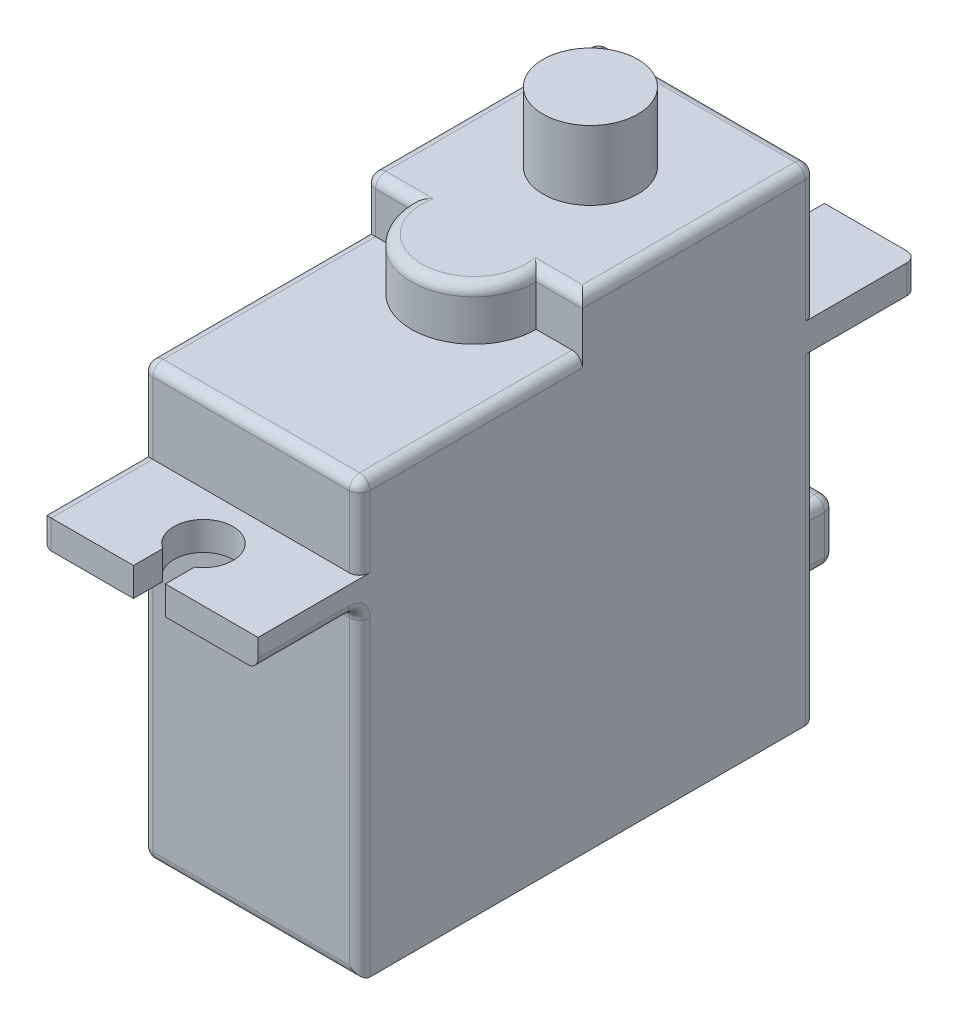
from build123d import *

# Parameters (mm, degrees)
BASE_SKETCH_W           = 13.3096
BASE_SKETCH_H           = 27.94
BASE_DEPTH              = 19.6977
MOUNTING_POINT_SKETCH_W = 13.3096
MOUNTING_POINT_SKETCH_H = 40.386
MOUNTING_POINT_DEPTH    = 1.7526
MOUNTING_HOLES_DEPTH    = 43.477892971
MIDDLE_SKETCH_W         = 13.3096
MIDDLE_SKETCH_H         = 27.94
MIDDLE_DEPTH            = 4.9911
TOP_EXTRUDE_DEPTH       = 3.1496
GEAR_SKETCH_R           = 2.9083
GEAR_DEPTH              = 4.2418
SERVO_CABLE_SKETCH_W    = 5.3594
SERVO_CABLE_SKETCH_H    = 3.6576
SEVO_CABLE_DEPTH        = 5.1562
FILLET1_R               = 0.635


with BuildPart() as part:
    # Base Sketch → Base (new body)
    with BuildSketch(Plane(origin=(0, 0, 0), x_dir=(1, 0, 0), z_dir=(0, 1, 0))):
        with Locations((6.6548, 13.97)):
            Rectangle(BASE_SKETCH_W, BASE_SKETCH_H)
    extrude(amount=BASE_DEPTH)

    # Mounting Point Sketch → Mounting Point (add)
    with BuildSketch(Plane(origin=(0, 19.6977, 0), x_dir=(1, 0, 0), z_dir=(0, 1, 0))):
        with Locations((6.6548, 13.97)):
            Rectangle(MOUNTING_POINT_SKETCH_W, MOUNTING_POINT_SKETCH_H)
    extrude(amount=MOUNTING_POINT_DEPTH)

    # Mounting Holes Sketch → Mounting Holes (cut, through all)
    with BuildSketch(Plane(origin=(0, 21.4503, 0), x_dir=(1, 0, 0), z_dir=(0, 1, 0))):
        with BuildLine():
            Line((5.6769, 34.163), (7.6327, 34.163))
            Line((7.6327, 34.163), (7.6327, 32.37744567))
            ThreePointArc((7.6327, 32.37744567), (6.6548, 29.0449), (5.6769, 32.37744567))
            Line((5.6769, 32.37744567), (5.6769, 34.163))
        make_face()
        with BuildLine():
            Line((5.6769, -6.223), (7.6327, -6.223))
            Line((7.6327, -6.223), (7.6327, -4.43744567))
            ThreePointArc((7.6327, -4.43744567), (6.6548, -1.1049), (5.6769, -4.43744567))
            Line((5.6769, -4.43744567), (5.6769, -6.223))
        make_face()
    extrude(amount=-MOUNTING_HOLES_DEPTH, mode=Mode.SUBTRACT)

    # Middle Sketch → Middle (add)
    with BuildSketch(Plane(origin=(0, 21.4503, 0), x_dir=(1, 0, 0), z_dir=(0, 1, 0))):
        with Locations((6.6548, 13.97)):
            Rectangle(MIDDLE_SKETCH_W, MIDDLE_SKETCH_H)
    extrude(amount=MIDDLE_DEPTH)

    # Top Sketch → Top extrude (add)
    with BuildSketch(Plane(origin=(0, 26.4414, 0), x_dir=(1, 0, 0), z_dir=(0, 1, 0))):
        with BuildLine():
            Line((0, 27.94), (13.3096, 27.94))
            Line((13.3096, 27.94), (13.3096, 13.6525))
            Line((13.3096, 13.6525), (10.4775, 13.6525))
            ThreePointArc((10.4775, 13.6525), (6.6548, 9.8298), (2.8321, 13.6525))
            Line((2.8321, 13.6525), (0, 13.6525))
            Line((0, 13.6525), (0, 27.94))
        make_face()
    extrude(amount=TOP_EXTRUDE_DEPTH)

    # Gear Sketch → Gear (add)
    with BuildSketch(Plane(origin=(0, 29.591, 0), x_dir=(1, 0, 0), z_dir=(0, 1, 0))):
        with Locations((6.6548, 20.79625)):
            Circle(GEAR_SKETCH_R)
    extrude(amount=GEAR_DEPTH)

    # Servo Cable Sketch → Sevo Cable (add)
    with BuildSketch(Plane(origin=(0, 0, -27.94), x_dir=(-1, 0, 0), z_dir=(0, 0, -1))):
        with Locations((-6.6548, 5.5626)):
            Rectangle(SERVO_CABLE_SKETCH_W, SERVO_CABLE_SKETCH_H)
    extrude(amount=SEVO_CABLE_DEPTH)

    # Fillet1
    fillet1_edges = [part.edges().sort_by_distance(p)[0] for p in [
        (13.3096, 19.6977, 3.1115),
        (0, 9.84885, -27.94),
        (0, 19.6977, -31.0515),
        (0, 20.574, -34.163),
        (0, 21.4503, -31.0515),
        (0, 25.52065, -27.94),
        (0, 29.591, -20.79625),
        (0, 28.0162, -13.6525),
        (0, 26.4414, -6.82625),
        (0, 23.94585, 0),
        (0, 21.4503, 3.1115),
        (0, 20.574, 6.223),
        (0, 19.6977, 3.1115),
        (0, 0, -13.97),
        (0, 9.84885, 0),
        (6.6548, 19.6977, 0),
        (13.3096, 9.84885, 0),
        (6.6548, 0, 0),
        (9.3345, 5.5626, -33.0962),
        (6.6548, 3.7338, -33.0962),
        (3.9751, 5.5626, -33.0962),
        (6.6548, 7.3914, -33.0962),
        (3.9751, 7.3914, -30.5181),
        (3.9751, 3.7338, -30.5181),
        (9.3345, 3.7338, -30.5181),
        (9.3345, 7.3914, -30.5181),
        (6.6548, 0, -27.94),
        (13.3096, 9.84885, -27.94),
        (13.3096, 29.591, -20.79625),
        (13.3096, 23.94585, 0),
        (6.6548, 26.4414, 0),
        (13.3096, 26.4414, -6.82625),
        (11.89355, 29.591, -13.6525),
        (1.41605, 29.591, -13.6525),
        (6.6548, 29.591, -9.8298),
        (6.6548, 29.591, -27.94),
        (13.3096, 25.52065, -27.94),
        (13.3096, 20.574, -34.163),
    ]]
    fillet(fillet1_edges, radius=FILLET1_R)


solid = part.part
